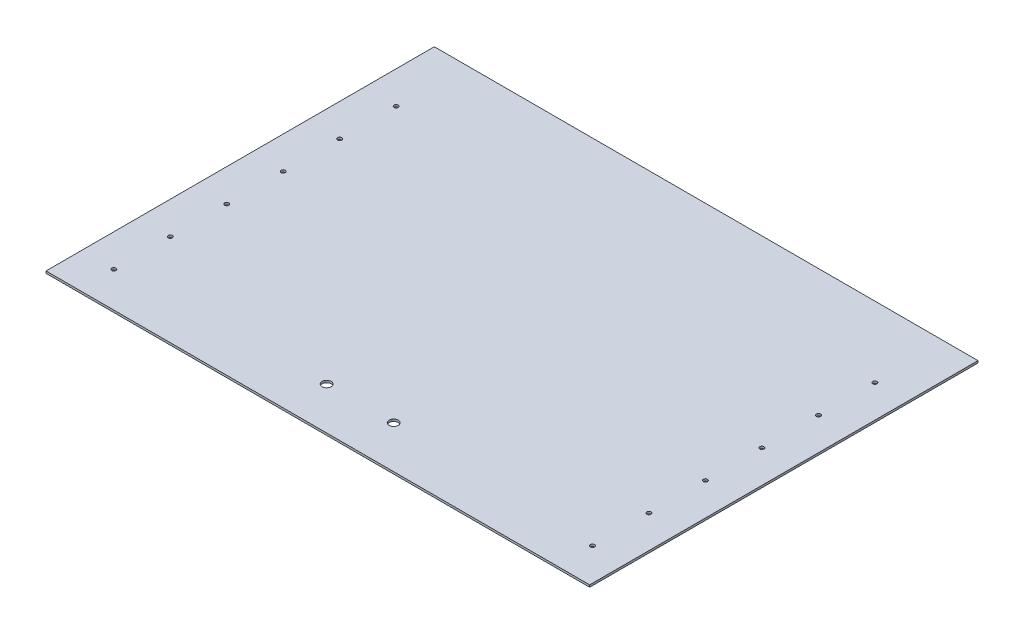
from build123d import *

# Parameters (mm, degrees)
SKETCH1_W          = 770
SKETCH1_H          = 550
SKETCH1_R          = 3
SKETCH1_R_2        = 6.5
BASE_FLANGE1_DEPTH = 3


# Sheet-metal steps are written as plain solids
with BuildPart() as part:
    # Sketch1 → Base-Flange1 (new body)
    with BuildSketch(Plane(origin=(0, 0, 0), x_dir=(1, 0, 0), z_dir=(0, 1, 0))):
        Rectangle(SKETCH1_W, SKETCH1_H)
        with Locations(Location((-339, 175, 0), (0, 0, 270))):
            Circle(SKETCH1_R, mode=Mode.SUBTRACT)
        with Locations(Location((-339, 95, 0), (0, 0, 270))):
            Circle(SKETCH1_R, mode=Mode.SUBTRACT)
        with Locations(Location((-339, 15, 0), (0, 0, 270))):
            Circle(SKETCH1_R, mode=Mode.SUBTRACT)
        with Locations(Location((-339, -65, 0), (0, 0, 270))):
            Circle(SKETCH1_R, mode=Mode.SUBTRACT)
        with Locations(Location((-339, -145, 0), (0, 0, 270))):
            Circle(SKETCH1_R, mode=Mode.SUBTRACT)
        with Locations(Location((-339, -225, 0), (0, 0, 270))):
            Circle(SKETCH1_R, mode=Mode.SUBTRACT)
        with Locations(Location((339, -225, 0), (0, 0, 90))):
            Circle(SKETCH1_R, mode=Mode.SUBTRACT)
        with Locations(Location((339, -145, 0), (0, 0, 90))):
            Circle(SKETCH1_R, mode=Mode.SUBTRACT)
        with Locations(Location((339, -65, 0), (0, 0, 90))):
            Circle(SKETCH1_R, mode=Mode.SUBTRACT)
        with Locations(Location((339, 15, 0), (0, 0, 90))):
            Circle(SKETCH1_R, mode=Mode.SUBTRACT)
        with Locations(Location((339, 95, 0), (0, 0, 90))):
            Circle(SKETCH1_R, mode=Mode.SUBTRACT)
        with Locations(Location((339, 175, 0), (0, 0, 90))):
            Circle(SKETCH1_R, mode=Mode.SUBTRACT)
        with Locations(Location((-47.5, -215, 0), (0, 0, 270))):
            Circle(SKETCH1_R_2, mode=Mode.SUBTRACT)
        with Locations(Location((47.5, -215, 0), (0, 0, 90))):
            Circle(SKETCH1_R_2, mode=Mode.SUBTRACT)
    extrude(amount=-BASE_FLANGE1_DEPTH)


solid = part.part
